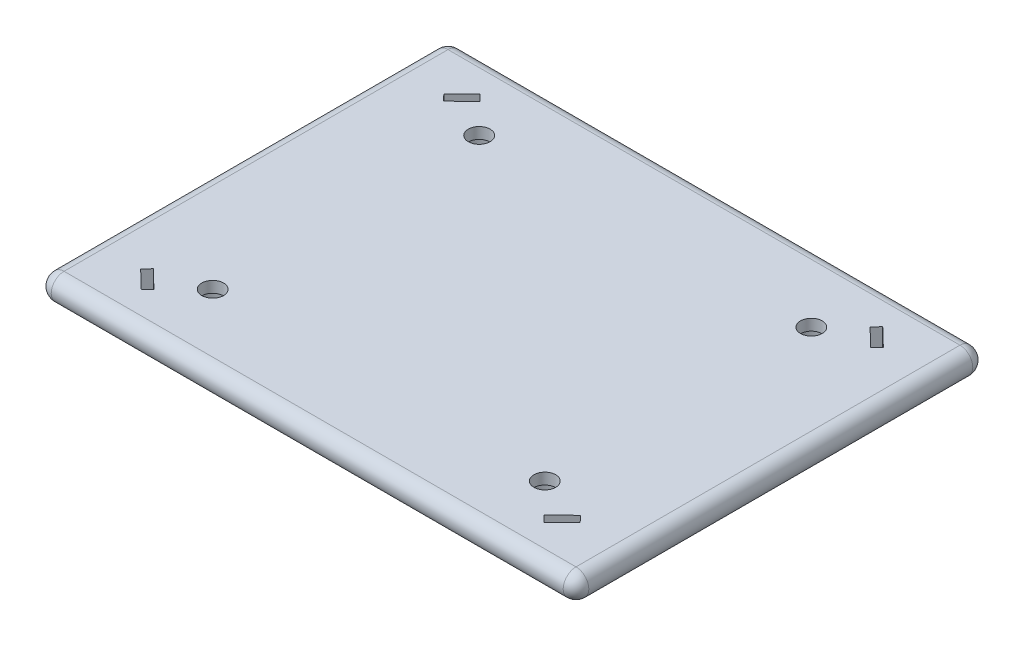
from build123d import *

# Parameters (mm, degrees)
EXTRUDE_1_DEPTH              = 20
HOLE_WIZARD_5_8_1_AT_2_COUNT = 2
HOLE_WIZARD_5_8_1_AT_2_PITCH = 259.490550386
HOLE_WIZARD_5_8_1_AT_3_COUNT = 2
HOLE_WIZARD_5_8_1_AT_3_PITCH = 208.21625411
HOLE_WIZARD_5_8_1_AT_4_COUNT = 2
HOLE_WIZARD_5_8_1_AT_4_PITCH = 332.700096506
FILLET_1_R                   = 10


with BuildPart() as part:
    # 草图2 → 凸台-拉伸1 (new body)
    with BuildSketch(Plane(origin=(0, 0, 0), x_dir=(1, 0, 0), z_dir=(0, 1, 0))):
        with BuildLine():
            Line((-200, 160), (200, 160))
            ThreePointArc((200, 160), (207.071067812, 157.071067812), (210, 150))
            Line((210, 150), (210, 0))
            Line((210, 0), (210, -150))
            ThreePointArc((210, -150), (207.071067812, -157.071067812), (200, -160))
            Line((200, -160), (-200, -160))
            ThreePointArc((-200, -160), (-207.071067812, -157.071067812), (-210, -150))
            Line((-210, -150), (-210, 0))
            Line((-210, 0), (-210, 150))
            ThreePointArc((-210, 150), (-207.071067812, 157.071067812), (-200, 160))
        make_face()
        Polygon((-157.328690373, 132.321363833), (-171.715726709, 118.428445296), (-166.853205221, 113.392982578), (-152.466168885, 127.285901115), align=None, mode=Mode.SUBTRACT)
        Polygon((-171.715726709, -118.428445296), (-166.853205221, -113.392982578), (-152.466168885, -127.285901115), (-157.328690373, -132.321363833), align=None, mode=Mode.SUBTRACT)
        Polygon((157.328690373, -132.321363833), (171.715726709, -118.428445296), (166.853205221, -113.392982578), (152.466168885, -127.285901115), align=None, mode=Mode.SUBTRACT)
        Polygon((171.715726709, 118.428445296), (166.853205221, 113.392982578), (152.466168885, 127.285901115), (157.328690373, 132.321363833), align=None, mode=Mode.SUBTRACT)
    extrude(amount=EXTRUDE_1_DEPTH)

    # 草图16 → 5/8 六角头螺钉的柱形沉头孔1 (revolve, cut)
    with BuildSketch(Plane(origin=(-129.745275193, 0, 104.108127055), x_dir=(0, 0, -1), z_dir=(1, 0, 0))):
        Polygon((0, 0), (0, 20), (8.53313, 20), (8.53313, 11.2776), (17.4625, 11.2776), (17.4625, 0.532828266), (18.0975, 0), align=None)
    hole_wizard_5_8_1 = revolve(axis=Axis((-129.745275193, -6.35, 104.108127055), (0, 1, 0)), mode=Mode.SUBTRACT)

    # 5/8 六角头螺钉的柱形沉头孔1 at 2: 5/8 六角头螺钉的柱形沉头孔1 ×2
    with Locations(*[(i * HOLE_WIZARD_5_8_1_AT_2_PITCH, 0, 0) for i in range(1, HOLE_WIZARD_5_8_1_AT_2_COUNT)]):
        add(hole_wizard_5_8_1, mode=Mode.SUBTRACT)

    # 5/8 六角头螺钉的柱形沉头孔1 at 3: 5/8 六角头螺钉的柱形沉头孔1 ×2
    with Locations(*[(0, 0, -i * HOLE_WIZARD_5_8_1_AT_3_PITCH) for i in range(1, HOLE_WIZARD_5_8_1_AT_3_COUNT)]):
        add(hole_wizard_5_8_1, mode=Mode.SUBTRACT)

    # 5/8 六角头螺钉的柱形沉头孔1 at 4: 5/8 六角头螺钉的柱形沉头孔1 ×2
    with Locations(*[Vector(0.779953336687125, 0, -0.6258376727160331) * (i * HOLE_WIZARD_5_8_1_AT_4_PITCH) for i in range(1, HOLE_WIZARD_5_8_1_AT_4_COUNT)]):
        add(hole_wizard_5_8_1, mode=Mode.SUBTRACT)

    # 圆角1
    fillet_1_edges = [part.edges().sort_by_distance(p)[0] for p in [
        (-210, 0, 0),
        (0, 0, -160),
        (210, 0, 0),
        (0, 20, -160),
        (-210, 20, 0),
        (0, 20, 160),
        (210, 20, 0),
        (0, 0, 160),
        (207.071067812, 20, -157.071067812),
        (-207.071067812, 0, 157.071067812),
        (-207.071067812, 0, -157.071067812),
        (207.071067812, 20, 157.071067812),
    ]]
    fillet(fillet_1_edges, radius=FILLET_1_R - 0.0001)  # a hair under: the kernel refuses the full size


solid = part.part
